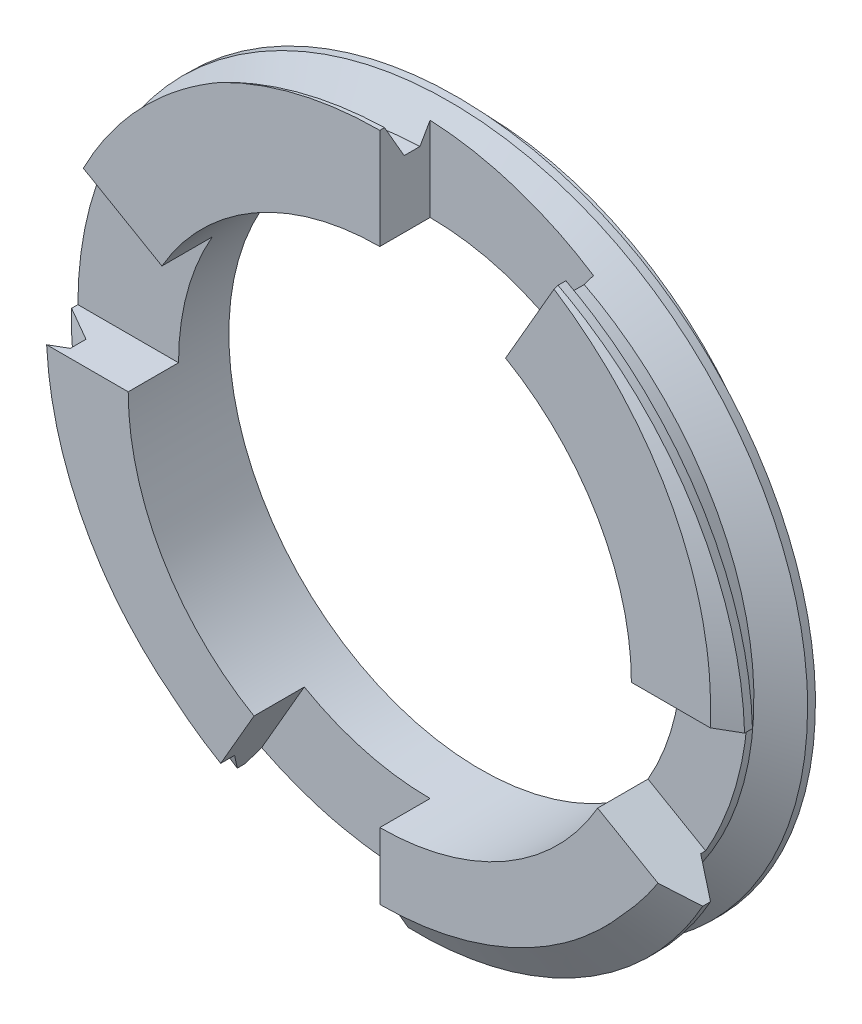
from build123d import *

# Parameters (mm, degrees)
SKETCH1_R           = 7
BOSS_EXTRUDE1_DEPTH = 2
SKETCH2_R           = 5
CUT_EXTRUDE1_DEPTH  = 2
CUT_EXTRUDE2_DEPTH  = 1
THREAD2_PITCH       = 1.25


with BuildPart() as part:
    # Sketch1 → Boss-Extrude1 (new body)
    with BuildSketch(Plane(origin=(0, 0, 0), x_dir=(0, 1, 0), z_dir=(0, 0, 1))):
        with Locations(Location((0, 0, 0), (0, 0, 270))):
            Circle(SKETCH1_R)
    extrude(amount=BOSS_EXTRUDE1_DEPTH)

    # Sketch2 → Cut-Extrude1 (cut)
    with BuildSketch(Plane.XY.offset(2)):
        Circle(SKETCH2_R)
    extrude(amount=-CUT_EXTRUDE1_DEPTH, mode=Mode.SUBTRACT)

    # Sketch5 → Cut-Extrude2 (cut)
    with BuildSketch(Plane.XY.offset(2)):
        with BuildLine():
            Line((0, 7), (0, 5))
            ThreePointArc((0, 5), (1.294095226, 4.829629131), (2.5, 4.330127019))
            Line((2.5, 4.330127019), (3.5, 6.062177826))
            ThreePointArc((3.5, 6.062177826), (1.811733316, 6.761480784), (0, 7))
        make_face()
        with BuildLine():
            Line((7, 0), (5, 0))
            ThreePointArc((5, 0), (4.829629131, -1.294095226), (4.330127019, -2.5))
            Line((4.330127019, -2.5), (6.062177826, -3.5))
            ThreePointArc((6.062177826, -3.5), (6.761480784, -1.811733316), (7, 0))
        make_face()
        with BuildLine():
            Line((0, -7), (0, -5))
            ThreePointArc((0, -5), (-1.294095226, -4.829629131), (-2.5, -4.330127019))
            Line((-2.5, -4.330127019), (-3.5, -6.062177826))
            ThreePointArc((-3.5, -6.062177826), (-1.811733316, -6.761480784), (0, -7))
        make_face()
        with BuildLine():
            Line((-7, 0), (-5, 0))
            ThreePointArc((-5, 0), (-4.829629131, 1.294095226), (-4.330127019, 2.5))
            Line((-4.330127019, 2.5), (-6.062177826, 3.5))
            ThreePointArc((-6.062177826, 3.5), (-6.761480784, 1.811733316), (-7, 0))
        make_face()
    extrude(amount=-CUT_EXTRUDE2_DEPTH, mode=Mode.SUBTRACT)

    # Thread2: the profile of Thread Profile2 profile screwed along a right-hand helix of 4 turns, 8 arcs to a turn; built about Z, then put on its axis
    thread2_z = Axis((0, 0, 0), (0, 0, 1))
    thread2_corners = [(7.0003, 0, -0.000173205), (7.0003, 0, 1.093923202), (6.323417656, 0, 0.703124998), (6.323417656, 0, 0.390624998)]
    with BuildLine(mode=Mode.PRIVATE) as thread2_profile:
        Line(thread2_corners[0], thread2_corners[1])
        Line(thread2_corners[1], thread2_corners[2])
        Line(thread2_corners[2], thread2_corners[3])
        Line(thread2_corners[3], thread2_corners[0])
    thread2_cap = Face(thread2_profile.wire())
    thread2_turn_angles = [0, 22.5, 45, 67.5, 90, 112.5, 135, 157.5, 180, 202.5, 225, 247.5, 270, 292.5, 315, 337.5, 360]
    thread2_turn_weights = [1, 0.9238795325112867, 1, 0.9238795325112867, 1, 0.9238795325112867, 1, 0.9238795325112867, 1, 0.9238795325112867, 1, 0.9238795325112867, 1, 0.9238795325112867, 1, 0.9238795325112867, 1]
    thread2_turn_rails = [Edge.make_bspline([Vector(p[0], p[1], 0).rotate(thread2_z, thread2_turn_angles[k]) / thread2_turn_weights[k] + Vector(0, 0, p[2] + THREAD2_PITCH * thread2_turn_angles[k] / 360) for k in range(17)], [0, 0, 0, 1, 1, 2, 2, 3, 3, 4, 4, 5, 5, 6, 6, 7, 7, 8, 8, 8], 2, thread2_turn_weights) for p in thread2_corners]
    thread2_turn_sides = [Face.make_surface_from_curves(thread2_turn_rails[p[0]], thread2_turn_rails[p[1]]) for p in [(0, 1), (1, 2), (2, 3), (3, 0)]]
    thread2 = Plane(origin=(0, 0, -2), x_dir=(1, 0, 0), z_dir=(0, 0, 1)) * Solid(Shell([*[p.moved(Location((0, 0, THREAD2_PITCH * i))) for i in range(4) for p in thread2_turn_sides], thread2_cap, thread2_cap.rotate(thread2_z, 1440).moved(Location((0, 0, THREAD2_PITCH * 1440 / 360)))]))
    add(thread2, mode=Mode.SUBTRACT)


solid = part.part
